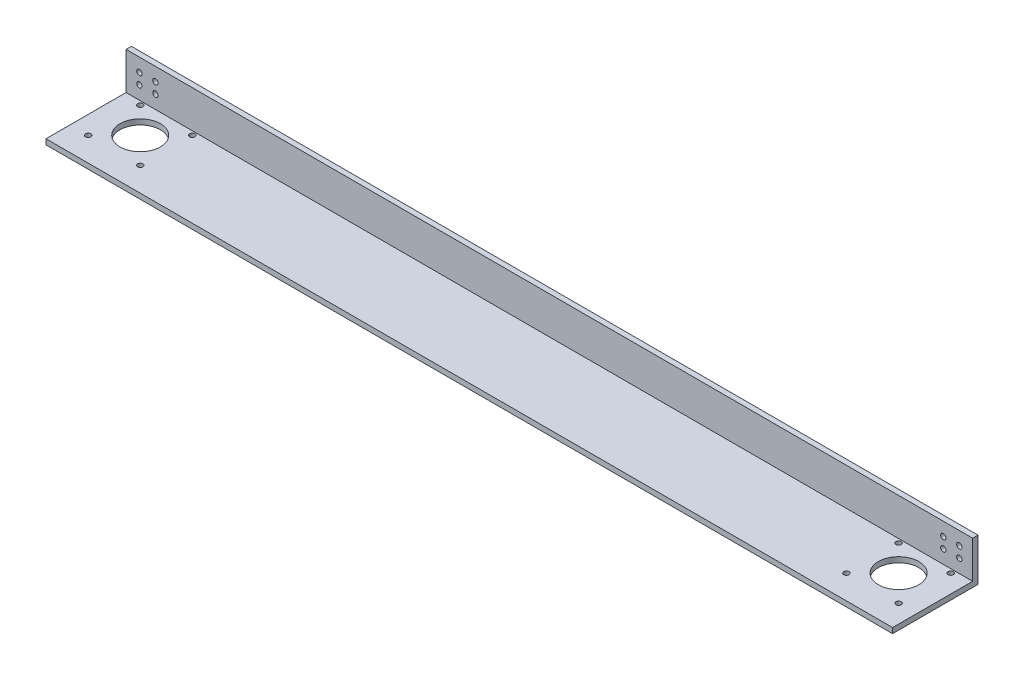
from build123d import *

# Parameters (mm, degrees)
BOSS_EXTRUDE1_DEPTH              = 503.65
TOPHOLES_SKETCH2_R               = 12
TOPHOLES_SKETCH2_R_2             = 1.5875
TOPHOLES_CUT_EXTRUDE1_DEPTH      = 507.693115332
BACKSIDEHOLES_SKETCH3_R          = 1.5875
BACKSIDEHOLES_CUT_EXTRUDE2_DEPTH = 507.842305357


with BuildPart() as part:
    # Sketch1 → Boss-Extrude1 (new body)
    with BuildSketch(Plane(origin=(0, 0, 0), x_dir=(0, 0, -1), z_dir=(1, 0, 0))):
        Polygon((0, 0), (-50.8, 0), (-50.8, 3.175), (-3.175, 3.175), (-3.175, 25.4), (0, 25.4), align=None)
    extrude(amount=BOSS_EXTRUDE1_DEPTH)

    # TopHoles-Sketch2 → TopHoles-Cut-Extrude1 (cut, through all)
    with BuildSketch(Plane(origin=(0, 3.175, 0), x_dir=(1, 0, 0), z_dir=(0, 1, 0))):
        with Locations((26.25, -21)):
            Circle(TOPHOLES_SKETCH2_R)
        with Locations((477.4, -21)):
            Circle(TOPHOLES_SKETCH2_R)
        with Locations((10.75, -5.5)):
            Circle(TOPHOLES_SKETCH2_R_2)
        with Locations((41.75, -5.5)):
            Circle(TOPHOLES_SKETCH2_R_2)
        with Locations((461.9, -5.5)):
            Circle(TOPHOLES_SKETCH2_R_2)
        with Locations((492.9, -5.5)):
            Circle(TOPHOLES_SKETCH2_R_2)
        with Locations((10.75, -36.5)):
            Circle(TOPHOLES_SKETCH2_R_2)
        with Locations((41.75, -36.5)):
            Circle(TOPHOLES_SKETCH2_R_2)
        with Locations((461.9, -36.5)):
            Circle(TOPHOLES_SKETCH2_R_2)
        with Locations((492.9, -36.5)):
            Circle(TOPHOLES_SKETCH2_R_2)
    extrude(amount=-TOPHOLES_CUT_EXTRUDE1_DEPTH, mode=Mode.SUBTRACT)

    # BackSideHoles-Sketch3 → BackSideHoles-Cut-Extrude2 (cut, through all)
    with BuildSketch(Plane(origin=(0, 0, 0), x_dir=(-1, 0, 0), z_dir=(0, 0, -1))):
        with Locations((-495.7125, 17.4625)):
            Circle(BACKSIDEHOLES_SKETCH3_R)
        with Locations((-486.1875, 17.4625)):
            Circle(BACKSIDEHOLES_SKETCH3_R)
        with Locations((-495.7125, 11.1125)):
            Circle(BACKSIDEHOLES_SKETCH3_R)
        with Locations((-486.1875, 11.1125)):
            Circle(BACKSIDEHOLES_SKETCH3_R)
        with Locations((-7.9375, 11.1125)):
            Circle(BACKSIDEHOLES_SKETCH3_R)
        with Locations((-17.4625, 11.1125)):
            Circle(BACKSIDEHOLES_SKETCH3_R)
        with Locations((-17.4625, 17.4625)):
            Circle(BACKSIDEHOLES_SKETCH3_R)
        with Locations((-7.9375, 17.4625)):
            Circle(BACKSIDEHOLES_SKETCH3_R)
    extrude(amount=-BACKSIDEHOLES_CUT_EXTRUDE2_DEPTH, mode=Mode.SUBTRACT)


solid = part.part
